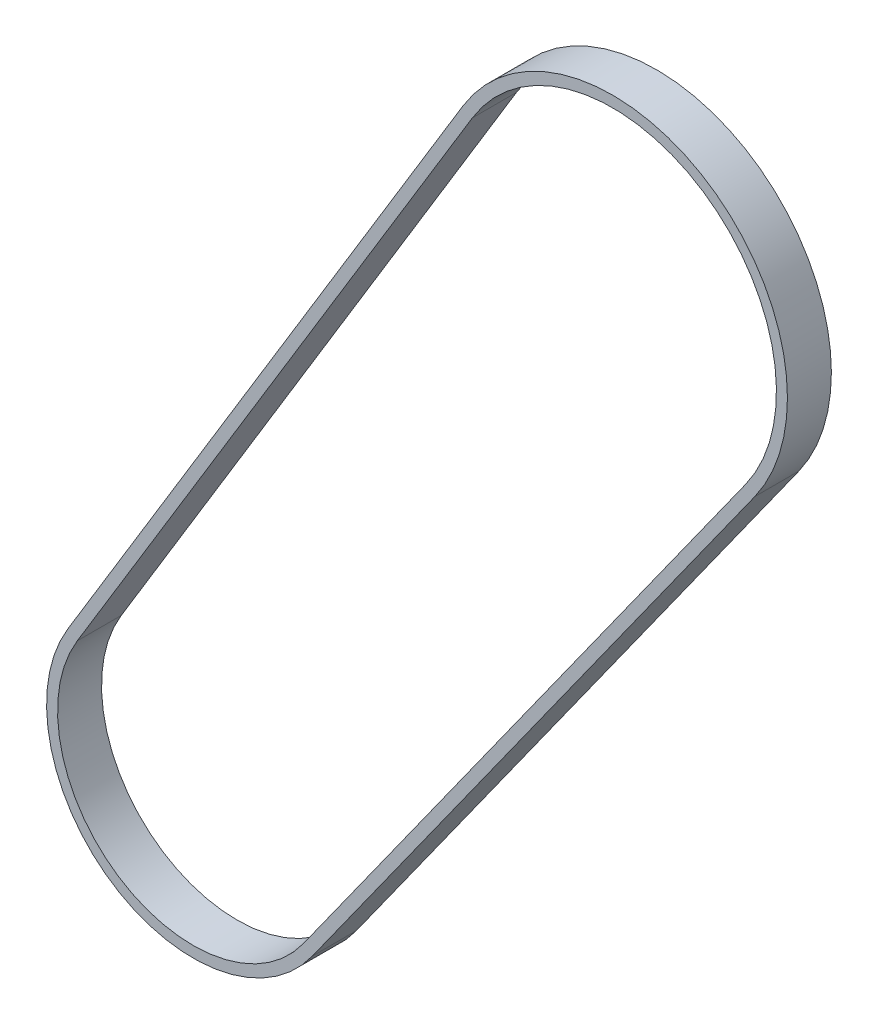
from build123d import *

# Parameters (mm, degrees)
EXTRUDE_THIN1_DEPTH = 6


with BuildPart() as part:
    # Sketch2 → Extrude-Thin1 (new body)
    with BuildSketch(Plane.XY):
        with BuildLine():
            Line((-17.093252698, 10.383675274), (36.854141929, 99.190039534))
            ThreePointArc((36.854141929, 99.190039534), (70.408140063, 106.723673085), (76.685769814, 72.912169273))
            Line((76.685769814, 72.912169273), (16.272158497, -11.62827837))
            ThreePointArc((16.272158497, -11.62827837), (-11.013631314, -16.69430817), (-17.093252698, 10.383675274))
        make_face()
        with BuildLine():
            Line((-15.811258746, 9.604899629), (38.136135881, 98.411263888))
            ThreePointArc((38.136135881, 98.411263888), (69.582117715, 105.471599972), (75.465357926, 73.784290151))
            Line((75.465357926, 73.784290151), (15.05174661, -10.756157492))
            ThreePointArc((15.05174661, -10.756157492), (-10.187608966, -15.442235057), (-15.811258746, 9.604899629))
        make_face(mode=Mode.SUBTRACT)
    extrude(amount=-EXTRUDE_THIN1_DEPTH)


solid = part.part
